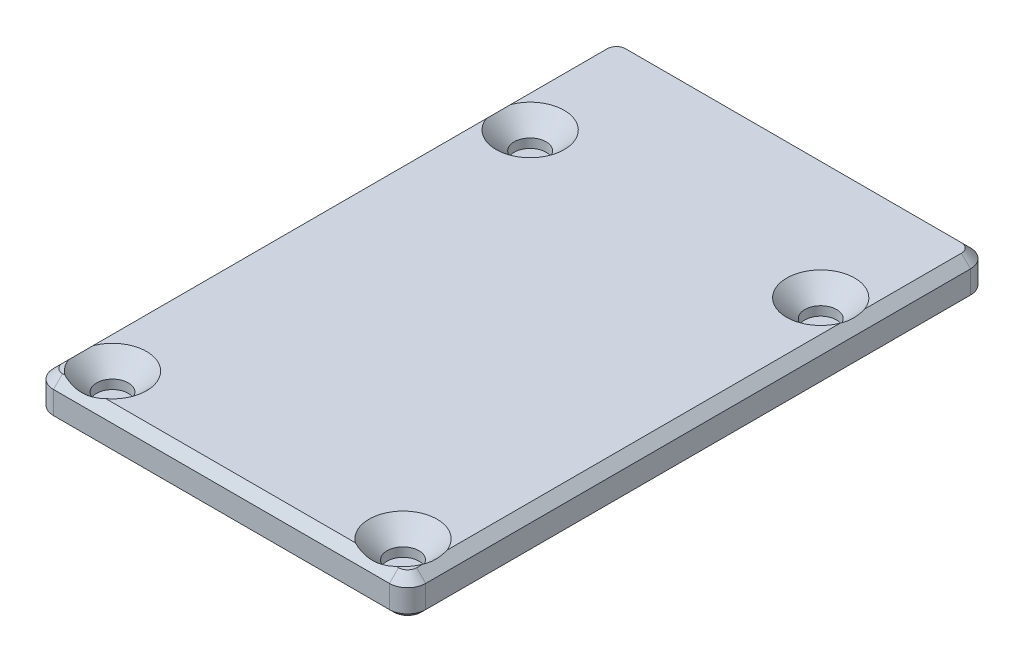
from build123d import *

# Parameters (mm, degrees)
SKETCH_1_W          = 41
SKETCH_1_H          = 64
EXTRUDE_1_DEPTH     = 4
SKETCH_2_R          = 1.75
CUT_EXTRUDE_1_DEPTH = 3
FILLET_1_R          = 2
CHAMFER_2_SIZE      = 1
CHAMFER_1_SIZE      = 2
CHAMFER_3_SIZE      = 0.5


with BuildPart() as part:
    # Эскиз1 → Бобышка-Вытянуть1 (new body)
    with BuildSketch(Plane(origin=(0, 0, 0), x_dir=(1, 0, 0), z_dir=(0, 1, 0))):
        Rectangle(SKETCH_1_W, SKETCH_1_H)
    extrude(amount=EXTRUDE_1_DEPTH)

    # Эскиз2 → Вырез-Вытянуть1 (cut)
    with BuildSketch(Plane(origin=(0, 4, 0), x_dir=(1, 0, 0), z_dir=(0, 1, 0))):
        with Locations(Location((16, 18, 0), (0, 0, 270))):
            Circle(SKETCH_2_R)
        with Locations(Location((16, -28, 0), (0, 0, 90))):
            Circle(SKETCH_2_R)
        with Locations(Location((-16, 18, 0), (0, 0, 90))):
            Circle(SKETCH_2_R)
        with Locations(Location((-16, -28, 0), (0, 0, 270))):
            Circle(SKETCH_2_R)
    extrude(amount=-CUT_EXTRUDE_1_DEPTH, mode=Mode.SUBTRACT)

    # Скругление1
    fillet_1_edges = [part.edges().sort_by_distance(p)[0] for p in [
        (20.5, 2, 32),
        (-20.5, 2, 32),
        (-20.5, 2, -32),
        (20.5, 2, -32),
    ]]
    fillet(fillet_1_edges, radius=FILLET_1_R)

    # Фаска2
    chamfer_2_edges = [part.edges().sort_by_distance(p)[0] for p in [
        (0, 4, -32),
        (20.5, 4, 0),
        (-20.5, 4, 0),
        (0, 4, 32),
        (19.914213562, 4, 31.414213562),
        (-19.914213562, 4, 31.414213562),
        (-19.914213562, 4, -31.414213562),
        (19.914213562, 4, -31.414213562),
    ]]
    chamfer(chamfer_2_edges, length=CHAMFER_2_SIZE)

    # Фаска1
    # the kernel refuses this chamfer: 2 mm, written as the material it takes off along each edge
    with BuildSketch(Plane(origin=(-16, 4, -18), x_dir=(0, 0, -1), z_dir=(1, 0, 0))) as chamfer_1_piece_1:
        Polygon((1.75 + CHAMFER_1_SIZE, 0), (1.75, -CHAMFER_1_SIZE), (1.75, 0), align=None)
    revolve(axis=Axis((-16, 4, -18), (0, 1, 0)), mode=Mode.SUBTRACT)
    with BuildSketch(Plane(origin=(-16, 4, 28), x_dir=(0, 0, 1), z_dir=(-1, 0, 0))) as chamfer_1_piece_2:
        Polygon((1.75 + CHAMFER_1_SIZE, 0), (1.75, -CHAMFER_1_SIZE), (1.75, 0), align=None)
    revolve(axis=Axis((-16, 4, 28), (0, 1, 0)), mode=Mode.SUBTRACT)
    with BuildSketch(Plane(origin=(16, 4, 28), x_dir=(0, 0, -1), z_dir=(1, 0, 0))) as chamfer_1_piece_3:
        Polygon((1.75 + CHAMFER_1_SIZE, 0), (1.75, -CHAMFER_1_SIZE), (1.75, 0), align=None)
    revolve(axis=Axis((16, 4, 28), (0, 1, 0)), mode=Mode.SUBTRACT)
    with BuildSketch(Plane(origin=(16, 4, -18), x_dir=(0, 0, 1), z_dir=(-1, 0, 0))) as chamfer_1_piece_4:
        Polygon((1.75 + CHAMFER_1_SIZE, 0), (1.75, -CHAMFER_1_SIZE), (1.75, 0), align=None)
    revolve(axis=Axis((16, 4, -18), (0, 1, 0)), mode=Mode.SUBTRACT)

    # Фаска3
    chamfer_3_edges = [part.edges().sort_by_distance(p)[0] for p in [
        (0, 0, -32),
        (20.5, 0, 0),
        (0, 0, 32),
        (-20.5, 0, 0),
        (19.914213562, 0, 31.414213562),
        (-19.914213562, 0, 31.414213562),
        (-19.914213562, 0, -31.414213562),
        (19.914213562, 0, -31.414213562),
    ]]
    chamfer(chamfer_3_edges, length=CHAMFER_3_SIZE)


solid = part.part
